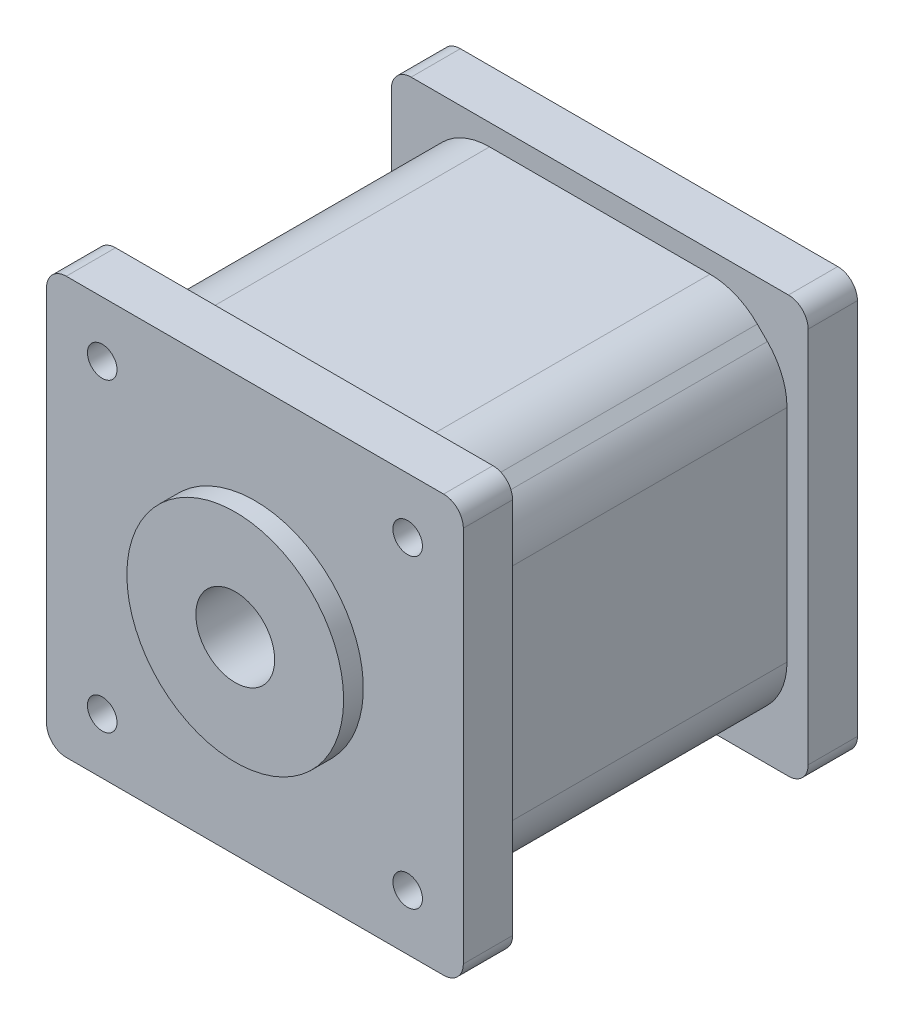
from build123d import *

# Parameters (mm, degrees)
EXTRUDE_1_DEPTH     = 5
EXTRUDE_2_DEPTH     = 30
EXTRUDE_4_DEPTH     = 5
SKETCH_4_R          = 1.5
CUT_EXTRUDE_1_DEPTH = 4.5
SKETCH_5_R          = 11
EXTRUDE_5_DEPTH     = 2
SKETCH_6_R          = 4
CUT_EXTRUDE_2_DEPTH = 20


with BuildPart() as part:
    # 草图1 → 凸台-拉伸1 (new body)
    with BuildSketch(Plane.XY):
        with BuildLine():
            Line((-19.15, -21.15), (19.15, -21.15))
            ThreePointArc((19.15, -21.15), (20.564213562, -20.564213562), (21.15, -19.15))
            Line((21.15, -19.15), (21.15, 19.15))
            ThreePointArc((21.15, 19.15), (20.564213562, 20.564213562), (19.15, 21.15))
            Line((19.15, 21.15), (-19.15, 21.15))
            ThreePointArc((-19.15, 21.15), (-20.564213562, 20.564213562), (-21.15, 19.15))
            Line((-21.15, 19.15), (-21.15, -19.15))
            ThreePointArc((-21.15, -19.15), (-20.564213562, -20.564213562), (-19.15, -21.15))
        make_face()
    extrude(amount=EXTRUDE_1_DEPTH)

    # 草图2 → 凸台-拉伸2 (add)
    with BuildSketch(Plane.XY.offset(5)):
        with BuildLine():
            Line((-17.011566207, 15.988433793), (-15.988433793, 17.011566207))
            ThreePointArc((-15.988433793, 17.011566207), (-13.785943914, 18.483222894), (-11.187929962, 19))
            Line((-11.187929962, 19), (11.187929962, 19))
            ThreePointArc((11.187929962, 19), (13.785943914, 18.483222894), (15.988433793, 17.011566207))
            Line((15.988433793, 17.011566207), (17.011566207, 15.988433793))
            ThreePointArc((17.011566207, 15.988433793), (18.483222894, 13.785943914), (19, 11.187929962))
            Line((19, 11.187929962), (19, -11.187929962))
            ThreePointArc((19, -11.187929962), (18.483222894, -13.785943914), (17.011566207, -15.988433793))
            Line((17.011566207, -15.988433793), (15.988433793, -17.011566207))
            ThreePointArc((15.988433793, -17.011566207), (13.785943914, -18.483222894), (11.187929962, -19))
            Line((11.187929962, -19), (-11.187929962, -19))
            ThreePointArc((-11.187929962, -19), (-13.785943914, -18.483222894), (-15.988433793, -17.011566207))
            Line((-15.988433793, -17.011566207), (-17.011566207, -15.988433793))
            ThreePointArc((-17.011566207, -15.988433793), (-18.483222894, -13.785943914), (-19, -11.187929962))
            Line((-19, -11.187929962), (-19, 11.187929962))
            ThreePointArc((-19, 11.187929962), (-18.483222894, 13.785943914), (-17.011566207, 15.988433793))
        make_face()
    extrude(amount=EXTRUDE_2_DEPTH)

    # 草图3 → 凸台-拉伸4 (add)
    with BuildSketch(Plane.XY.offset(35)):
        with BuildLine():
            Line((-19.15, -21.15), (19.15, -21.15))
            ThreePointArc((19.15, -21.15), (20.564213562, -20.564213562), (21.15, -19.15))
            Line((21.15, -19.15), (21.15, 19.15))
            ThreePointArc((21.15, 19.15), (20.564213562, 20.564213562), (19.15, 21.15))
            Line((19.15, 21.15), (-19.15, 21.15))
            ThreePointArc((-19.15, 21.15), (-20.564213562, 20.564213562), (-21.15, 19.15))
            Line((-21.15, 19.15), (-21.15, -19.15))
            ThreePointArc((-21.15, -19.15), (-20.564213562, -20.564213562), (-19.15, -21.15))
        make_face()
    extrude(amount=EXTRUDE_4_DEPTH)

    # 草图4 → 切除-拉伸1 (cut)
    with BuildSketch(Plane.XY.offset(40)):
        with Locations((15.5, 15.5)):
            Circle(SKETCH_4_R)
        with Locations((15.5, -15.5)):
            Circle(SKETCH_4_R)
        with Locations((-15.5, -15.5)):
            Circle(SKETCH_4_R)
        with Locations((-15.5, 15.5)):
            Circle(SKETCH_4_R)
    extrude(amount=-CUT_EXTRUDE_1_DEPTH, mode=Mode.SUBTRACT)

    # 草图5 → 凸台-拉伸5 (add)
    with BuildSketch(Plane.XY.offset(40)):
        Circle(SKETCH_5_R)
    extrude(amount=EXTRUDE_5_DEPTH)

    # 草图6 → 切除-拉伸2 (cut)
    with BuildSketch(Plane.XY.offset(42)):
        Circle(SKETCH_6_R)
    extrude(amount=-CUT_EXTRUDE_2_DEPTH, mode=Mode.SUBTRACT)


solid = part.part
